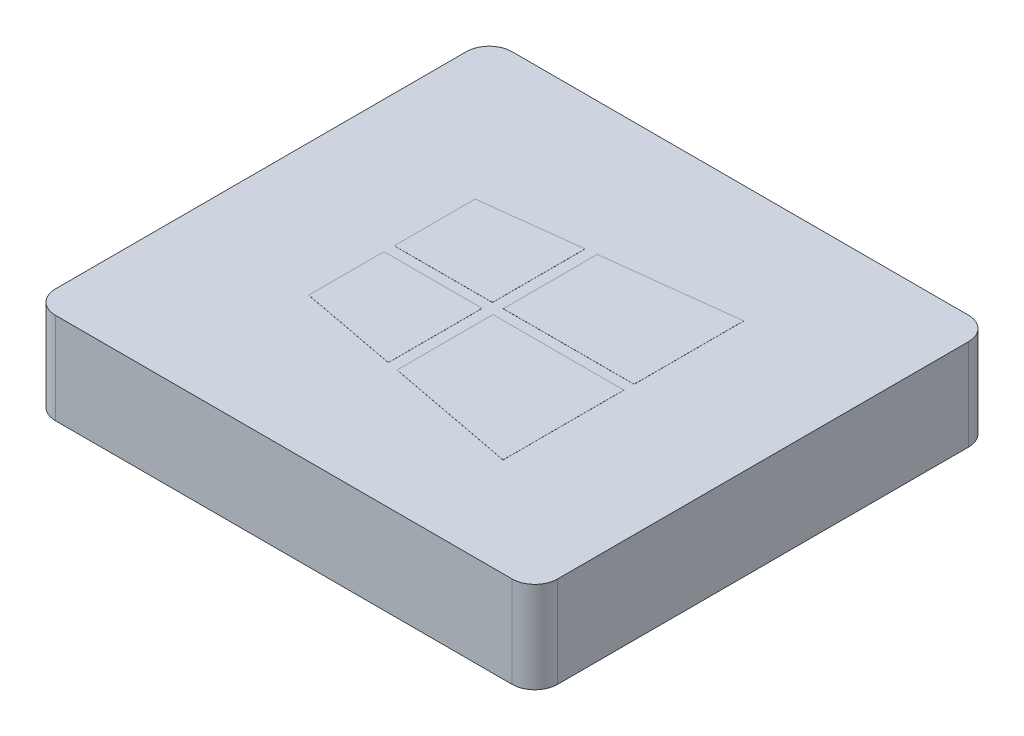
from build123d import *

# Parameters (mm, degrees)
SKETCH1_W           = 13.97
SKETCH1_H           = 12.7
BOSS_EXTRUDE1_DEPTH = 2.54
FILLET1_R           = 0.635
SHELL1_START        = 0.635
SHELL1_OUTLINE_W    = 1.905
SHELL1_OUTLINE_H    = 11.43
SHELL1_DEPTH        = 12.7
SKETCH2_R           = 2.54
BOSS_EXTRUDE2_DEPTH = 1.905
BOSS_EXTRUDE4_DEPTH = 0.00254


# Read off the part's stored shape, not the designer's step: Shell1
with BuildPart() as part:
    # Sketch1 → Boss-Extrude1 (new body)
    with BuildSketch(Plane(origin=(0, 0, 0), x_dir=(1, 0, 0), z_dir=(0, 1, 0))):
        with Locations((6.985, 6.35)):
            Rectangle(SKETCH1_W, SKETCH1_H)
    extrude(amount=BOSS_EXTRUDE1_DEPTH)

    # Fillet1
    fillet1_edges = [part.edges().sort_by_distance(p)[0] for p in [
        (0, 1.27, -12.7),
        (13.97, 1.27, -12.7),
        (13.97, 1.27, 0),
        (0, 1.27, 0),
    ]]
    fillet(fillet1_edges, radius=FILLET1_R)

    # Shell1 outline → Shell1 (cut)
    with BuildSketch(Plane.YZ.offset(SHELL1_START)):
        with Locations((0.9525, -6.35)):
            Rectangle(SHELL1_OUTLINE_W, SHELL1_OUTLINE_H)
    extrude(amount=SHELL1_DEPTH, mode=Mode.SUBTRACT)

    # Sketch2 → Boss-Extrude2 (add)
    with BuildSketch(Plane(origin=(0, 1.905, 0), x_dir=(-1, 0, 0), z_dir=(0, -1, 0))):
        with Locations(Location((-6.985, 6.35, 0), (0, 0, 270))):
            Circle(SKETCH2_R)
    extrude(amount=BOSS_EXTRUDE2_DEPTH)

    # Sketch5 → Boss-Extrude4 (add)
    with BuildSketch(Plane(origin=(0, 2.54, 0), x_dir=(1, 0, 0), z_dir=(0, 1, 0))):
        Polygon((3.675799971, 8.636881907), (6.405771964, 8.963367107), (6.405771964, 6.385040601), (3.675799971, 6.385040601), align=None)
        Polygon((3.675799971, 6.099704546), (3.675799971, 4.006611728), (6.405771964, 3.488506251), (6.405771964, 6.099704546), align=None)
        Polygon((6.706531591, 8.999335816), (6.706531591, 6.385040601), (10.345846979, 6.385040601), (10.345846979, 9.434572007), align=None)
        Polygon((6.706531591, 6.099704546), (6.706531591, 3.431426834), (10.345846979, 2.740742373), (10.345846979, 6.099704546), align=None)
    extrude(amount=BOSS_EXTRUDE4_DEPTH)


solid = part.part
